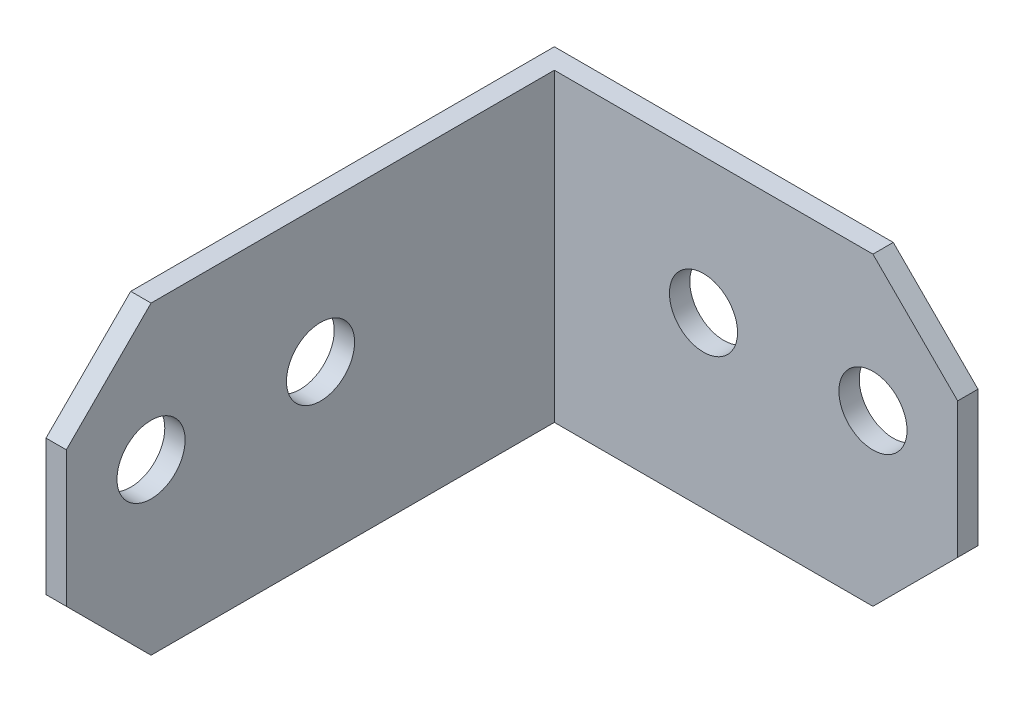
from build123d import *

# Parameters (mm, degrees)
BOSS_EXTRUDE1_DEPTH = 22.86
SKETCH2_R           = 2.5527
CUT_EXTRUDE1_DEPTH  = 54.73826082
SKETCH3_R           = 2.5527
CUT_EXTRUDE2_DEPTH  = 54.55787408
CHAMFER1_SIZE       = 6.35


with BuildPart() as part:
    # Sketch1 → Boss-Extrude1 (new body)
    with BuildSketch(Plane(origin=(0, 0, 0), x_dir=(1, 0, 0), z_dir=(0, 1, 0))):
        Polygon((0, 0), (0, 38.1), (31.75, 38.1), (31.75, 36.576), (1.524, 36.576), (1.524, 0), align=None)
    extrude(amount=BOSS_EXTRUDE1_DEPTH)

    # Sketch2 → Cut-Extrude1 (cut, through all)
    with BuildSketch(Plane(origin=(1.524, 0, 0), x_dir=(0, 0, -1), z_dir=(1, 0, 0))):
        with Locations((6.35, 12.7)):
            Circle(SKETCH2_R)
        with Locations((19.05, 12.7)):
            Circle(SKETCH2_R)
    extrude(amount=-CUT_EXTRUDE1_DEPTH, mode=Mode.SUBTRACT)

    # Sketch3 → Cut-Extrude2 (cut, through all)
    with BuildSketch(Plane.XY.offset(-36.576)):
        with Locations((25.4, 12.7)):
            Circle(SKETCH3_R)
        with Locations((12.7, 12.7)):
            Circle(SKETCH3_R)
    extrude(amount=-CUT_EXTRUDE2_DEPTH, mode=Mode.SUBTRACT)

    # Chamfer1
    chamfer1_edges = [part.edges().sort_by_distance(p)[0] for p in [
        (0.762, 0, 0),
        (31.75, 0, -37.338),
        (0.762, 22.86, 0),
        (31.75, 22.86, -37.338),
    ]]
    chamfer(chamfer1_edges, length=CHAMFER1_SIZE)


solid = part.part
